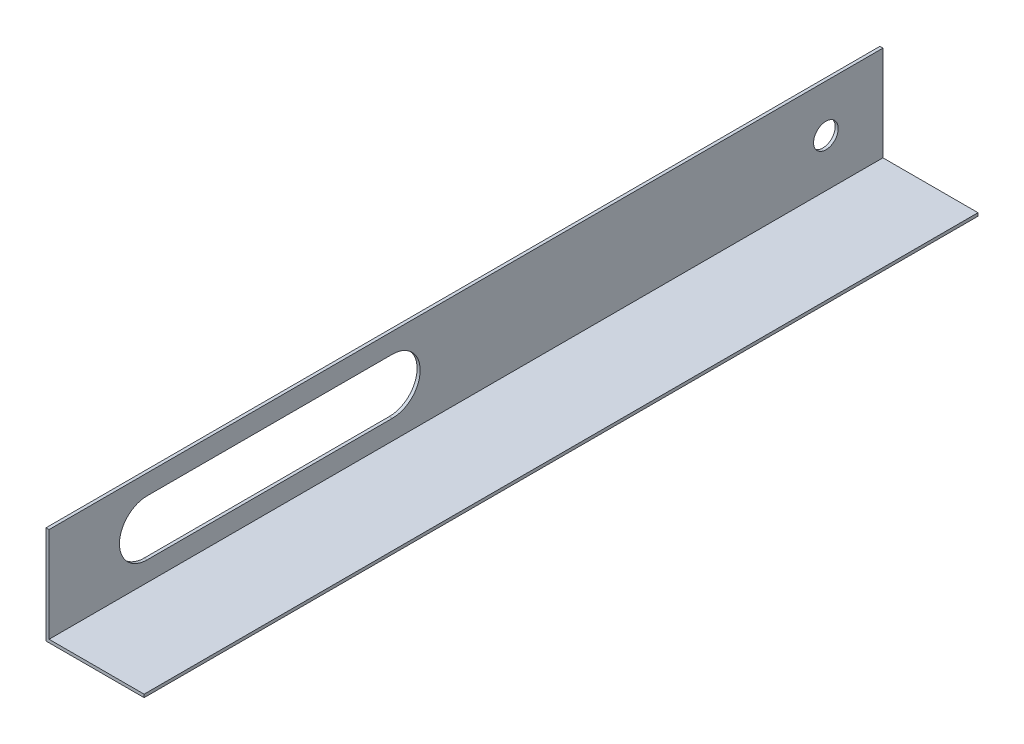
from build123d import *

# Parameters (mm, degrees)
BOSS_EXTRUDE2_DEPTH = 431.8
CUT_EXTRUDE3_DEPTH  = 127
SKETCH7_R           = 6.3881
CUT_EXTRUDE4_DEPTH  = 127


with BuildPart() as part:
    # Sketch3 → Boss-Extrude2 (new body)
    with BuildSketch(Plane.XY):
        Polygon((0, 0), (0, 49.2125), (-1.5875, 49.2125), (-1.5875, -1.5875), (49.2125, -1.5875), (49.2125, 0), align=None)
    extrude(amount=BOSS_EXTRUDE2_DEPTH)

    # Sketch6 → Cut-Extrude3 (cut)
    with BuildSketch(Plane(origin=(0, 0, 0), x_dir=(0, 0, -1), z_dir=(1, 0, 0))):
        with BuildLine():
            Line((-381, 38.9255), (-254, 38.9255))
            ThreePointArc((-254, 38.9255), (-239.649, 24.5745), (-254, 10.2235))
            Line((-254, 10.2235), (-381, 10.2235))
            ThreePointArc((-381, 10.2235), (-395.351, 24.5745), (-381, 38.9255))
        make_face()
    extrude(amount=-CUT_EXTRUDE3_DEPTH, mode=Mode.SUBTRACT)

    # Sketch7 → Cut-Extrude4 (cut)
    with BuildSketch(Plane(origin=(0, 0, 0), x_dir=(0, 0, -1), z_dir=(1, 0, 0))):
        with Locations((-29.538792285, 24.773594829)):
            Circle(SKETCH7_R)
    extrude(amount=-CUT_EXTRUDE4_DEPTH, mode=Mode.SUBTRACT)


solid = part.part
